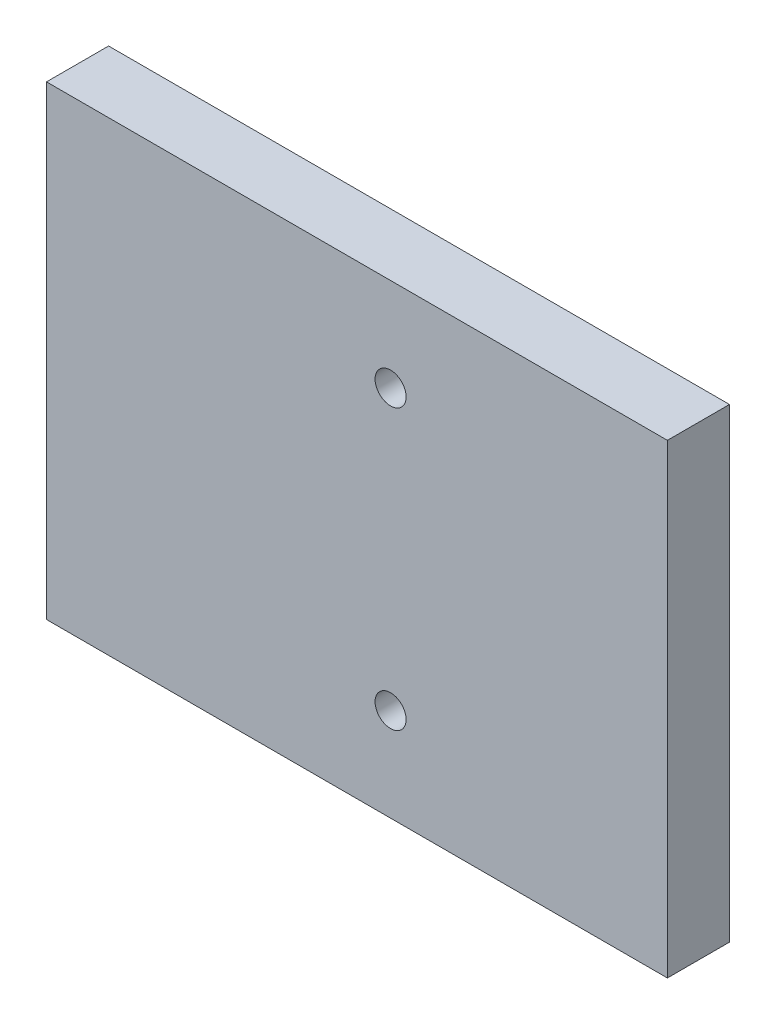
from build123d import *

# Parameters (mm, degrees)
SKETCH1_W               = 60
SKETCH1_H               = 45
BOSS_EXTRUDE1_DEPTH     = 6
CUT_EXTRUDE1_DEPTH      = 86.495814294
CUT_EXTRUDE1_DEPTH_BACK = 7.5
SKETCH2_R               = 1.5


with BuildPart() as part:
    # Sketch1 → Boss-Extrude1 (new body)
    with BuildSketch(Plane.XY):
        with Locations((30, 22.5)):
            Rectangle(SKETCH1_W, SKETCH1_H)
    extrude(amount=BOSS_EXTRUDE1_DEPTH)

    # Sketch2 → Cut-Extrude1 (cut, two sides: drawn at the far end of the back side and taken through both)
    with BuildSketch(Plane(origin=(67.434592899, 22.5, -41.495893953), x_dir=(0, 1, 0), z_dir=(0, 0, 1)).offset(-CUT_EXTRUDE1_DEPTH_BACK)):
        with Locations((13.5, 34.184592899)):
            Circle(SKETCH2_R)
        with Locations((-13.5, 34.184592899)):
            Circle(SKETCH2_R)
    extrude(amount=CUT_EXTRUDE1_DEPTH + CUT_EXTRUDE1_DEPTH_BACK, mode=Mode.SUBTRACT)


solid = part.part
